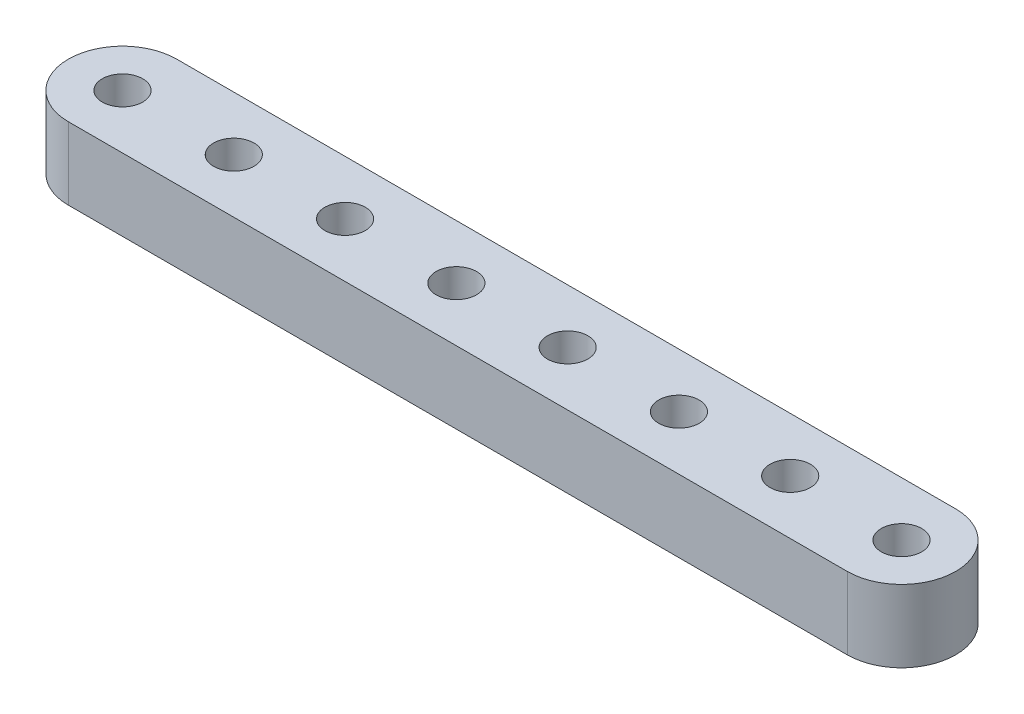
from build123d import *

# Parameters (mm, degrees)
SKETCH1_R               = 1.778
BOSS_EXTRUDE1_DEPTH     = 6.35
CUT_EXTRUDE1_DEPTH      = 45.59065674
CUT_EXTRUDE1_DEPTH_BACK = 45.59065674
SKETCH2_W               = 15.126003495
SKETCH2_H               = 9.710924743
FILLET1_R               = 4.7625


with BuildPart() as part:
    # Sketch1 → Boss-Extrude1 (new body)
    with BuildSketch(Plane.XZ):
        with BuildLine():
            Line((-39.116, -4.7625), (39.116, -4.7625))
            ThreePointArc((39.116, -4.7625), (43.8785, 0), (39.116, 4.7625))
            Line((39.116, 4.7625), (-39.116, 4.7625))
            ThreePointArc((-39.116, 4.7625), (-43.8785, 0), (-39.116, -4.7625))
        make_face()
        with Locations(Location((39.116, 0, 0), (0, 0, 90))):
            Circle(SKETCH1_R, mode=Mode.SUBTRACT)
        with Locations(Location((29.337, 0, 0), (0, 0, 90))):
            Circle(SKETCH1_R, mode=Mode.SUBTRACT)
        with Locations(Location((19.558, 0, 0), (0, 0, 90))):
            Circle(SKETCH1_R, mode=Mode.SUBTRACT)
        with Locations(Location((9.779, 0, 0), (0, 0, 90))):
            Circle(SKETCH1_R, mode=Mode.SUBTRACT)
        with Locations(Location((0, 0, 0), (0, 0, 90))):
            Circle(SKETCH1_R, mode=Mode.SUBTRACT)
        with Locations(Location((-9.779, 0, 0), (0, 0, 90))):
            Circle(SKETCH1_R, mode=Mode.SUBTRACT)
        with Locations(Location((-19.558, 0, 0), (0, 0, 90))):
            Circle(SKETCH1_R, mode=Mode.SUBTRACT)
        with Locations(Location((-29.337, 0, 0), (0, 0, 90))):
            Circle(SKETCH1_R, mode=Mode.SUBTRACT)
        with Locations(Location((-39.116, 0, 0), (0, 0, 90))):
            Circle(SKETCH1_R, mode=Mode.SUBTRACT)
    extrude(amount=-BOSS_EXTRUDE1_DEPTH)

    # Sketch2 → Cut-Extrude1 (cut, two sides: drawn at the far end of the back side and taken through both)
    with BuildSketch(Plane(origin=(0, 6.35, 0), x_dir=(1, 0, 0), z_dir=(0, 1, 0)).offset(-CUT_EXTRUDE1_DEPTH_BACK)):
        with Locations((-41.662501748, 0.092962372)):
            Rectangle(SKETCH2_W, SKETCH2_H)
    extrude(amount=CUT_EXTRUDE1_DEPTH + CUT_EXTRUDE1_DEPTH_BACK, mode=Mode.SUBTRACT)

    # Fillet1
    fillet1_edges = [part.edges().sort_by_distance(p)[0] for p in [
        (-34.0995, 3.175, -4.7625),
        (-34.0995, 3.175, 4.7625),
    ]]
    fillet(fillet1_edges, radius=FILLET1_R - 0.0001)  # a hair under: the kernel refuses the full size


solid = part.part
